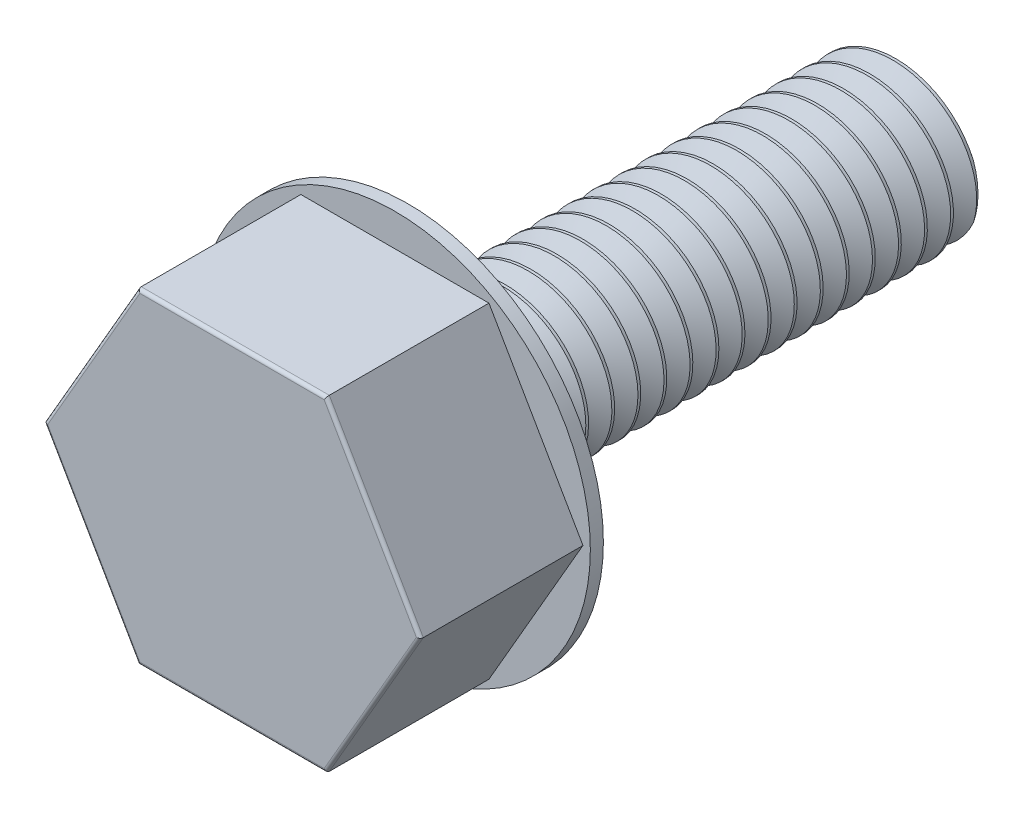
from build123d import *

# Parameters (mm, degrees)
SKETCH3_R           = 2.5
BOSS_EXTRUDE1_DEPTH = 15
SKETCH18_R          = 6
BOSS_EXTRUDE2_DEPTH = 0.4
CUT_SWEEP3_PITCH    = 0.8
CUT_SWEEP3_TO       = 15
BOSS_EXTRUDE3_DEPTH = 5
FILLET2_R           = 0.1


with BuildPart() as part:
    # Sketch3 → Boss-Extrude1 (new body)
    with BuildSketch(Plane(origin=(0, 0, 0), x_dir=(0, 1, 0), z_dir=(0, 0, 1))):
        with Locations(Location((0, 0, 0), (0, 0, 270))):
            Circle(SKETCH3_R)
    extrude(amount=BOSS_EXTRUDE1_DEPTH)

    # Sketch18 → Boss-Extrude2 (add)
    with BuildSketch(Plane.XY.offset(15)):
        Circle(SKETCH18_R)
    extrude(amount=BOSS_EXTRUDE2_DEPTH)

    # Cut-Sweep3: arcs per turn and ends read off the stored shape
    # Cut-Sweep3: the profile of Sketch23 screwed along a right-hand helix through 21 turns, 8 arcs to a turn; built about Z, then put on its axis
    cut_sweep3_z = Axis((0, 0, 0), (0, 0, 1))
    cut_sweep3_corners = [(1.880676393, 0, -0.8), (2.809661804, 0, -1.336349977), (2.809661804, 0, -0.263650023)]
    with BuildLine(mode=Mode.PRIVATE) as cut_sweep3_profile:
        Line(cut_sweep3_corners[0], cut_sweep3_corners[1])
        Line(cut_sweep3_corners[1], cut_sweep3_corners[2])
        Line(cut_sweep3_corners[2], cut_sweep3_corners[0])
    cut_sweep3_cap = Face(cut_sweep3_profile.wire())
    cut_sweep3_turn_angles = [0, 22.5, 45, 67.5, 90, 112.5, 135, 157.5, 180, 202.5, 225, 247.5, 270, 292.5, 315, 337.5, 360]
    cut_sweep3_turn_weights = [1, 0.9238795325112867, 1, 0.9238795325112867, 1, 0.9238795325112867, 1, 0.9238795325112867, 1, 0.9238795325112867, 1, 0.9238795325112867, 1, 0.9238795325112867, 1, 0.9238795325112867, 1]
    cut_sweep3_turn_rails = [Edge.make_bspline([Vector(p[0], p[1], 0).rotate(cut_sweep3_z, cut_sweep3_turn_angles[k]) / cut_sweep3_turn_weights[k] + Vector(0, 0, p[2] + CUT_SWEEP3_PITCH * cut_sweep3_turn_angles[k] / 360) for k in range(17)], [0, 0, 0, 1, 1, 2, 2, 3, 3, 4, 4, 5, 5, 6, 6, 7, 7, 8, 8, 8], 2, cut_sweep3_turn_weights) for p in cut_sweep3_corners]
    cut_sweep3_turn_sides = [Face.make_surface_from_curves(cut_sweep3_turn_rails[p[0]], cut_sweep3_turn_rails[p[1]]) for p in [(0, 1), (1, 2), (2, 0)]]
    cut_sweep3_turn = Solid(Shell([*cut_sweep3_turn_sides, cut_sweep3_cap, cut_sweep3_cap.rotate(cut_sweep3_z, 360).moved(Location((0, 0, CUT_SWEEP3_PITCH * 360 / 360)))]))
    cut_sweep3_each = [*[cut_sweep3_turn.moved(Location((0, 0, CUT_SWEEP3_PITCH * i))) for i in range(21)]]
    add(Plane(origin=(0, 0, 0), x_dir=(-1, 0, 0), z_dir=(0, 0, 1)) * split(Compound([cut_sweep3_each[i] for i in range(0, 21, 2)]), bisect_by=Plane.XY.offset(CUT_SWEEP3_TO), keep=Keep.BOTTOM, mode=Mode.PRIVATE), mode=Mode.SUBTRACT)
    add(Plane(origin=(0, 0, 0), x_dir=(-1, 0, 0), z_dir=(0, 0, 1)) * split(Compound([cut_sweep3_each[i] for i in range(1, 21, 2)]), bisect_by=Plane.XY.offset(CUT_SWEEP3_TO), keep=Keep.BOTTOM, mode=Mode.PRIVATE), mode=Mode.SUBTRACT)

    # Sketch24 → Boss-Extrude3 (add)
    with BuildSketch(Plane.XY.offset(15.4)):
        Polygon((5.773502692, 0), (2.886751346, 5), (-2.886751346, 5), (-5.773502692, 0), (-2.886751346, -5), (2.886751346, -5), align=None)
    extrude(amount=BOSS_EXTRUDE3_DEPTH)

    # Fillet2
    fillet2_edges = [part.edges().sort_by_distance(p)[0] for p in [
        (4.330127019, -2.5, 20.4),
        (4.330127019, 2.5, 20.4),
        (0, 5, 20.4),
        (-4.330127019, 2.5, 20.4),
        (-4.330127019, -2.5, 20.4),
        (0, -5, 20.4),
    ]]
    fillet(fillet2_edges, radius=FILLET2_R)


solid = part.part
